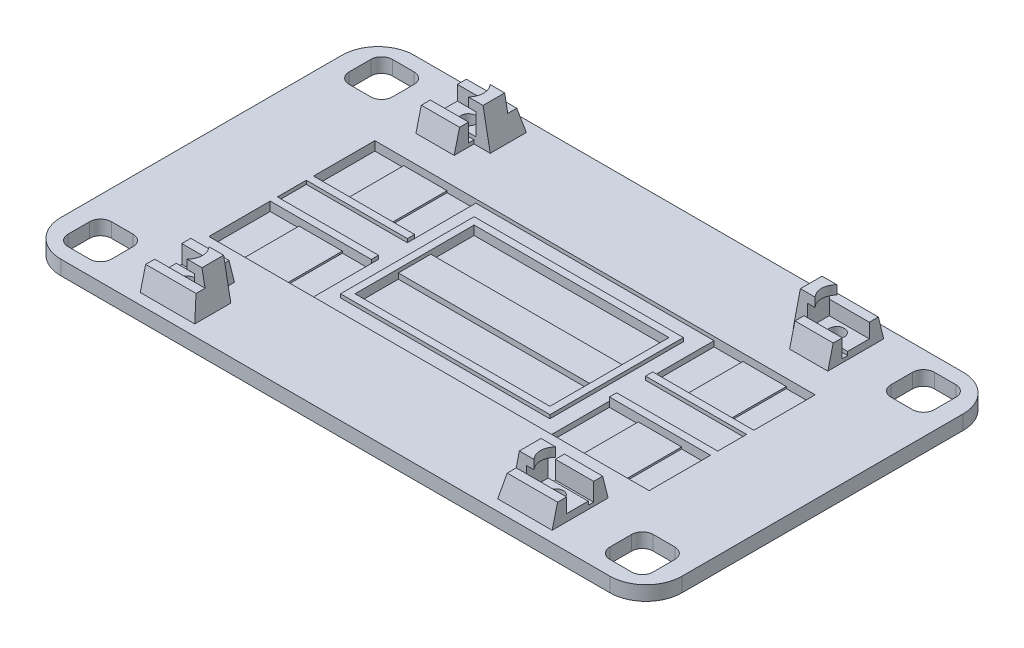
from build123d import *

# Parameters (mm, degrees)
SKETCH1_W                        = 34.5
SKETCH1_H                        = 8.741142107
BOSS_EXTRUDE3_DEPTH              = 4
SKETCH6_W                        = 11
SKETCH6_H                        = 11
BOSS_EXTRUDE4_DEPTH              = 2
CUT_EXTRUDE1_START               = -3
CUT_EXTRUDE1_DEPTH               = 24
SKETCH7_W                        = 11
SKETCH7_H                        = 2.5
SKETCH7_H_2                      = 1
BOSS_EXTRUDE5_DEPTH              = 4
SKETCH10_W                       = 3.083691557
SKETCH10_H                       = 13.597950321
CUT_EXTRUDE2_DEPTH               = 12
SKETCH11_W                       = 10.179154034
SKETCH11_H                       = 1.5
BOSS_EXTRUDE7_DEPTH              = 6
SKETCH12_W                       = 2.5
SKETCH12_H                       = 12.5
BOSS_EXTRUDE8_DEPTH              = 6
BOSS_EXTRUDE9_DEPTH              = 11.6
SKETCH21_R                       = 4.5
CUT_EXTRUDE9_DEPTH               = 3
CUT_EXTRUDE11_DEPTH              = 11.5
BOSS_EXTRUDE14_DEPTH             = 4
CUT_EXTRUDE12_START              = -1
SKETCH28_W                       = 13.111544153
SKETCH28_H                       = 1.5
CUT_EXTRUDE12_DEPTH              = 11
BOSS_EXTRUDE15_DEPTH             = 1.5
SKETCH30_W                       = 2.5
SKETCH30_H                       = 6
BOSS_EXTRUDE16_DEPTH             = 2
SKETCH31_W                       = 2.5
SKETCH31_H                       = 6
BOSS_EXTRUDE17_DEPTH             = 2.5
BOSS_EXTRUDE18_REACH             = 127.805
BOSS_EXTRUDE18_DIRECTION_2_REACH = 127.805
SKETCH34_W                       = 17.603907028
SKETCH34_H                       = 5.411961877
SKETCH34_H_2                     = 6.558600434
CUT_EXTRUDE13_DEPTH              = 4.5
BOSS_EXTRUDE20_DEPTH             = 11.6
MIRROR11_OUTLINE_R               = 4.5
MIRROR11_DEPTH                   = 3
MIRROR11_START                   = 3
MIRROR11_2_OUTLINE_R             = 2.069860115
MIRROR11_2_DEPTH                 = 1
MIRROR11_START_2                 = 4
MIRROR11_3_OUTLINE_R             = 2.069860115
MIRROR11_3_DEPTH                 = 2
MIRROR11_START_3                 = 6
MIRROR11_4_DEPTH                 = 4
MIRROR11_5_OUTLINE_W             = 13.1
MIRROR11_5_OUTLINE_H             = 1.5
MIRROR11_5_DEPTH                 = 1
MIRROR11_START_4                 = 12
MIRROR11_6_DEPTH                 = 2.5
MIRROR11_START_5                 = -59.844904725
MIRROR11_7_OUTLINE_W             = 6
MIRROR11_7_OUTLINE_H             = 2.5
MIRROR11_7_DEPTH                 = 15.1
MIRROR11_START_6                 = -49.244904725
MIRROR11_8_OUTLINE_W             = 10.5
MIRROR11_8_OUTLINE_H             = 6
MIRROR11_8_DEPTH                 = 4.5
MIRROR11_START_7                 = -46.744904725
MIRROR11_9_OUTLINE_W             = 6
MIRROR11_9_OUTLINE_H             = 1.5
MIRROR11_9_DEPTH                 = 2
MIRROR11_10_DEPTH                = 1.5
MIRROR11_START_8                 = -43.206197131
MIRROR11_11_DEPTH                = 3.206197131
BOSS_EXTRUDE21_DEPTH             = 11.6
CUT_EXTRUDE14_START              = -5
SKETCH37_W                       = 89.881860183
SKETCH37_H                       = 1.5
SKETCH37_W_2                     = 87.938782422
CUT_EXTRUDE14_DEPTH              = 5
SKETCH39_W                       = 7.636808492
SKETCH39_H                       = 7.005250269
CUT_EXTRUDE18_DEPTH              = 6
MIRROR13_COPY_1_SKETCH_W         = 7.636808492
MIRROR13_COPY_1_SKETCH_H         = 7.005250269
MIRROR13_COPY_1_DEPTH            = 6
SKETCH41_W                       = 6
SKETCH41_H                       = 6
CUT_EXTRUDE20_DEPTH              = 0.5
SKETCH42_W                       = 122
SKETCH42_H                       = 46
CUT_EXTRUDE21_DEPTH              = 1
SKETCH43_W                       = 24
SKETCH43_H                       = 2
BOSS_EXTRUDE23_DEPTH             = 1
SKETCH44_W                       = 4
SKETCH44_H                       = 17
CUT_EXTRUDE22_DEPTH              = 1.5
SKETCH45_W                       = 16
SKETCH45_H                       = 17
CUT_EXTRUDE23_DEPTH              = 1
SKETCH46_W                       = 58
SKETCH46_H                       = 37
SKETCH46_W_2                     = 54
SKETCH46_H_2                     = 33
BOSS_EXTRUDE25_DEPTH             = 1
SKETCH47_W                       = 54
SKETCH47_H                       = 12
CUT_EXTRUDE24_DEPTH              = 1.5
SKETCH48_W                       = 4
SKETCH48_H                       = 17
CUT_EXTRUDE25_DEPTH              = 1.5
SKETCH49_W                       = 4
SKETCH49_H                       = 17
CUT_EXTRUDE26_DEPTH              = 0.5
SKETCH50_W                       = 4
SKETCH50_H                       = 2
BOSS_EXTRUDE26_DEPTH             = 1


with BuildPart() as part:
    # Sketch1 → Boss-Extrude3 (new body)
    # profile 1 of 11: a face of its own
    with BuildSketch(Plane(origin=(0, 0, 0), x_dir=(1, 0, 0), z_dir=(0, 1, 0))):
        with BuildLine():
            Line((73.923306644, 42.779769086), (-59.063365063, 42.779769086))
            ThreePointArc((-59.063365063, 42.779769086), (-65.244285922, 40.219547838), (-67.804507169, 34.03862698))
            Line((-67.804507169, 34.03862698), (-67.804507169, -34.03862698))
            ThreePointArc((-67.804507169, -34.03862698), (-65.244285922, -40.219547838), (-59.063365063, -42.779769086))
            Line((-59.063365063, -42.779769086), (73.923306644, -42.779769086))
            ThreePointArc((73.923306644, -42.779769086), (80.104227503, -40.219547838), (82.664448751, -34.03862698))
            Line((82.664448751, -34.03862698), (82.664448751, 34.03862698))
            ThreePointArc((82.664448751, 34.03862698), (80.104227503, 40.219547838), (73.923306644, 42.779769086))
        make_face()
        with Locations((61.043877697, 34.03862698)):
            Rectangle(SKETCH1_W, SKETCH1_H, mode=Mode.SUBTRACT)
    # profile 2 of 11: a face of its own
    with BuildSketch(Plane(origin=(0, 0, 0), x_dir=(1, 0, 0), z_dir=(0, 1, 0))):
        with BuildLine():
            Line((78.293877697, 29.668055926), (78.293877697, 34.03862698))
            Line((78.293877697, 34.03862698), (74.273170351, 34.03862698))
            ThreePointArc((74.273170351, 34.03862698), (72.293877697, 32.059334326), (70.314585044, 34.03862698))
            Line((70.314585044, 34.03862698), (50.363737812, 34.03862698))
            ThreePointArc((50.363737812, 34.03862698), (48.293877697, 31.968766864), (46.224017582, 34.03862698))
            Line((46.224017582, 34.03862698), (43.793877697, 34.03862698))
            Line((43.793877697, 34.03862698), (43.793877697, 29.668055926))
            Line((43.793877697, 29.668055926), (78.293877697, 29.668055926))
        make_face()
    # profile 3 of 11: a face of its own
    with BuildSketch(Plane(origin=(0, 0, 0), x_dir=(1, 0, 0), z_dir=(0, 1, 0))):
        with BuildLine():
            Line((78.293877697, 34.03862698), (78.293877697, 38.409198033))
            Line((78.293877697, 38.409198033), (43.793877697, 38.409198033))
            Line((43.793877697, 38.409198033), (43.793877697, 34.03862698))
            Line((43.793877697, 34.03862698), (46.224017582, 34.03862698))
            ThreePointArc((46.224017582, 34.03862698), (48.293877697, 36.108487095), (50.363737812, 34.03862698))
            Line((50.363737812, 34.03862698), (70.314585044, 34.03862698))
            ThreePointArc((70.314585044, 34.03862698), (72.293877697, 36.017919633), (74.273170351, 34.03862698))
            Line((74.273170351, 34.03862698), (78.293877697, 34.03862698))
        make_face()
    # profile 4 of 11: a face of its own
    with BuildSketch(Plane(origin=(0, 0, 0), x_dir=(1, 0, 0), z_dir=(0, 1, 0))):
        with BuildLine():
            ThreePointArc((70.314585044, 34.03862698), (72.293877697, 32.059334326), (74.273170351, 34.03862698))
            Line((74.273170351, 34.03862698), (70.314585044, 34.03862698))
        make_face()
    # profile 5 of 11: a face of its own
    with BuildSketch(Plane(origin=(0, 0, 0), x_dir=(1, 0, 0), z_dir=(0, 1, 0))):
        with BuildLine():
            Line((70.314585044, 34.03862698), (74.273170351, 34.03862698))
            ThreePointArc((74.273170351, 34.03862698), (72.293877697, 36.017919633), (70.314585044, 34.03862698))
        make_face()
    # profile 6 of 11: a face of its own
    with BuildSketch(Plane(origin=(0, 0, 0), x_dir=(1, 0, 0), z_dir=(0, 1, 0))):
        with BuildLine():
            ThreePointArc((70.314585044, 34.03862698), (72.293877697, 32.059334326), (74.273170351, 34.03862698))
            Line((74.273170351, 34.03862698), (70.314585044, 34.03862698))
        make_face()
    # profile 7 of 11: a face of its own
    with BuildSketch(Plane(origin=(0, 0, 0), x_dir=(1, 0, 0), z_dir=(0, 1, 0))):
        with BuildLine():
            Line((70.314585044, 34.03862698), (74.273170351, 34.03862698))
            ThreePointArc((74.273170351, 34.03862698), (72.293877697, 36.017919633), (70.314585044, 34.03862698))
        make_face()
    # profile 8 of 11: a face of its own
    with BuildSketch(Plane(origin=(0, 0, 0), x_dir=(1, 0, 0), z_dir=(0, 1, 0))):
        with BuildLine():
            ThreePointArc((50.363737812, 34.03862698), (48.293877697, 36.108487095), (46.224017582, 34.03862698))
            Line((46.224017582, 34.03862698), (50.363737812, 34.03862698))
        make_face()
    # profile 9 of 11: a face of its own
    with BuildSketch(Plane(origin=(0, 0, 0), x_dir=(1, 0, 0), z_dir=(0, 1, 0))):
        with BuildLine():
            Line((50.363737812, 34.03862698), (46.224017582, 34.03862698))
            ThreePointArc((46.224017582, 34.03862698), (48.293877697, 31.968766864), (50.363737812, 34.03862698))
        make_face()
    # profile 10 of 11: a face of its own
    with BuildSketch(Plane(origin=(0, 0, 0), x_dir=(1, 0, 0), z_dir=(0, 1, 0))):
        with BuildLine():
            ThreePointArc((50.363737812, 34.03862698), (48.293877697, 36.108487095), (46.224017582, 34.03862698))
            Line((46.224017582, 34.03862698), (50.363737812, 34.03862698))
        make_face()
    # profile 11 of 11: a face of its own
    with BuildSketch(Plane(origin=(0, 0, 0), x_dir=(1, 0, 0), z_dir=(0, 1, 0))):
        with BuildLine():
            Line((50.363737812, 34.03862698), (46.224017582, 34.03862698))
            ThreePointArc((46.224017582, 34.03862698), (48.293877697, 31.968766864), (50.363737812, 34.03862698))
        make_face()
    extrude(amount=BOSS_EXTRUDE3_DEPTH)

    # Sketch6 → Boss-Extrude4 (add)
    with BuildSketch(Plane(origin=(0, 4, 0), x_dir=(1, 0, 0), z_dir=(0, 1, 0))):
        with Locations((48.114723663, 34.03862698)):
            Rectangle(SKETCH6_W, SKETCH6_H)
    boss_extrude4 = extrude(amount=BOSS_EXTRUDE4_DEPTH)

    # Sketch1<5> → Cut-Extrude1 (cut)
    with BuildSketch(Plane(origin=(0, 0, 0), x_dir=(1, 0, 0), z_dir=(0, 1, 0)).offset(CUT_EXTRUDE1_START)):
        with BuildLine():
            ThreePointArc((50.363737812, 34.03862698), (48.293877697, 36.108487095), (46.224017582, 34.03862698))
            Line((46.224017582, 34.03862698), (50.363737812, 34.03862698))
        make_face()
        with BuildLine():
            Line((50.363737812, 34.03862698), (46.224017582, 34.03862698))
            ThreePointArc((46.224017582, 34.03862698), (48.293877697, 31.968766864), (50.363737812, 34.03862698))
        make_face()
    cut_extrude1 = extrude(amount=CUT_EXTRUDE1_DEPTH, mode=Mode.SUBTRACT)

    # Sketch7 → Boss-Extrude5 (add)
    with BuildSketch(Plane(origin=(0, 6, 0), x_dir=(1, 0, 0), z_dir=(0, 1, 0))):
        with Locations((48.114723663, 38.28862698)):
            Rectangle(SKETCH7_W, SKETCH7_H)
        with Locations((48.114723663, 29.03862698)):
            Rectangle(SKETCH7_W, SKETCH7_H_2)
    boss_extrude5 = extrude(amount=BOSS_EXTRUDE5_DEPTH)

    # Sketch10 → Cut-Extrude2 (cut)
    with BuildSketch(Plane(origin=(0, 4, 0), x_dir=(1, 0, 0), z_dir=(0, 1, 0))):
        with Locations((54.335723476, 34.069991953)):
            Rectangle(SKETCH10_W, SKETCH10_H)
    cut_extrude2 = extrude(amount=CUT_EXTRUDE2_DEPTH, mode=Mode.SUBTRACT)

    # Sketch11 → Boss-Extrude7 (add)
    with BuildSketch(Plane(origin=(0, 4, 0), x_dir=(1, 0, 0), z_dir=(0, 1, 0))):
        with Locations((47.70430068, 27.78862698)):
            Rectangle(SKETCH11_W, SKETCH11_H)
    boss_extrude7 = extrude(amount=BOSS_EXTRUDE7_DEPTH)

    # Sketch12 → Boss-Extrude8 (add)
    with BuildSketch(Plane(origin=(0, 4, 0), x_dir=(1, 0, 0), z_dir=(0, 1, 0))):
        with Locations((42.443877697, 33.28862698)):
            Rectangle(SKETCH12_W, SKETCH12_H)
    boss_extrude8 = extrude(amount=BOSS_EXTRUDE8_DEPTH)

    # Sketch13 → Boss-Extrude9 (add)
    with BuildSketch(Plane.ZY.offset(-41.193877697)):
        Polygon((-27.03862698, 10), (-27.03862698, 4), (-25.53862698, 4), align=None)
        Polygon((-39.53862698, 10), (-39.53862698, 4), (-41.03862698, 4), align=None)
    extrude(amount=-BOSS_EXTRUDE9_DEPTH)

    # Sketch21 → Cut-Extrude9 (cut)
    with BuildSketch(Plane.XZ):
        with Locations(Location((48.293877697, -34.03862698, 0), (0, 0, 270))):
            Circle(SKETCH21_R)
    cut_extrude9 = extrude(amount=-CUT_EXTRUDE9_DEPTH, mode=Mode.SUBTRACT)

    # Sketch24 → Cut-Extrude11 (cut)
    with BuildSketch(Plane(origin=(0, 4, 0), x_dir=(1, 0, 0), z_dir=(0, 1, 0))):
        with BuildLine():
            Line((69.293877697, 40.03862698), (75.293877697, 40.03862698))
            ThreePointArc((75.293877697, 40.03862698), (77.415198041, 39.159947323), (78.293877697, 37.03862698))
            Line((78.293877697, 37.03862698), (78.293877697, 31.03862698))
            ThreePointArc((78.293877697, 31.03862698), (77.415198041, 28.917306636), (75.293877697, 28.03862698))
            Line((75.293877697, 28.03862698), (69.293877697, 28.03862698))
            ThreePointArc((69.293877697, 28.03862698), (67.172557354, 28.917306636), (66.293877697, 31.03862698))
            Line((66.293877697, 31.03862698), (66.293877697, 37.03862698))
            ThreePointArc((66.293877697, 37.03862698), (67.172557354, 39.159947323), (69.293877697, 40.03862698))
        make_face()
    cut_extrude11 = extrude(amount=-CUT_EXTRUDE11_DEPTH, mode=Mode.SUBTRACT)

    # Sketch26 → Boss-Extrude14 (add)
    with BuildSketch(Plane.XZ):
        with BuildLine():
            Line((-78.844904725, 53.842790723), (73.293877697, 53.842790723))
            ThreePointArc((73.293877697, 53.842790723), (80.364945509, 50.913858534), (83.293877697, 43.842790723))
            Line((83.293877697, 43.842790723), (83.293877697, -34.03862698))
            ThreePointArc((83.293877697, -34.03862698), (80.364945509, -41.109694791), (73.293877697, -44.03862698))
            Line((73.293877697, -44.03862698), (-78.844904725, -44.03862698))
            ThreePointArc((-78.844904725, -44.03862698), (-85.915972537, -41.109694791), (-88.844904725, -34.03862698))
            Line((-88.844904725, -34.03862698), (-88.844904725, 43.842790723))
            ThreePointArc((-88.844904725, 43.842790723), (-85.915972537, 50.913858534), (-78.844904725, 53.842790723))
        make_face()
        Polygon((39.621658068, -22.50744652), (81.471959084, -23.594467326), (79.917902441, -39.014138958), (77.090986998, -41.323408937), (59.598365076, -40.869055121), (39.621658068, -40.350179614), align=None, mode=Mode.SUBTRACT)
    extrude(amount=-BOSS_EXTRUDE14_DEPTH)

    # Sketch28 → Cut-Extrude12 (cut)
    with BuildSketch(Plane(origin=(0, 6, 0), x_dir=(1, 0, 0), z_dir=(0, 1, 0)).offset(CUT_EXTRUDE12_START)):
        with Locations((46.238105621, 30.28862698)):
            Rectangle(SKETCH28_W, SKETCH28_H)
    cut_extrude12 = extrude(amount=CUT_EXTRUDE12_DEPTH, mode=Mode.SUBTRACT)

    # Sketch29 → Boss-Extrude15 (add)
    with BuildSketch(Plane(origin=(52.793877697, 0, 0), x_dir=(0, 0, -1), z_dir=(1, 0, 0))):
        Polygon((37.03862698, 6), (31.03862698, 6), (31.03862698, 5), (29.53862698, 5), (29.53862698, 10), (27.03862698, 10), (25.53862698, 4), (41.03862698, 4), (39.53862698, 10), (37.03862698, 10), align=None)
    boss_extrude15 = extrude(amount=BOSS_EXTRUDE15_DEPTH)

    # Sketch30 → Boss-Extrude16 (add)
    with BuildSketch(Plane(origin=(0, 10, 0), x_dir=(1, 0, 0), z_dir=(0, 1, 0))):
        with Locations((42.443877697, 34.03862698)):
            Rectangle(SKETCH30_W, SKETCH30_H)
    boss_extrude16 = extrude(amount=BOSS_EXTRUDE16_DEPTH)

    # Sketch31 → Boss-Extrude17 (add)
    with BuildSketch(Plane(origin=(0, 12, 0), x_dir=(1, 0, 0), z_dir=(0, 1, 0))):
        with Locations((42.443877697, 34.03862698)):
            Rectangle(SKETCH31_W, SKETCH31_H)
        with BuildLine():
            Line((45.283479053, 37.03862698), (43.693877697, 37.03862698))
            Line((43.693877697, 37.03862698), (43.693877697, 31.03862698))
            Line((43.693877697, 31.03862698), (45.283479053, 31.03862698))
            ThreePointArc((45.283479053, 31.03862698), (44.043877697, 34.03862698), (45.283479053, 37.03862698))
        make_face()
    boss_extrude17 = extrude(amount=BOSS_EXTRUDE17_DEPTH)

    # Boss-Extrude18: up to this plane
    boss_extrude18_end = Plane(origin=(58.978536136, 4, -25.53862698), z_dir=(0, 0.2425356250363332, 0.9701425001453319))
    # Sketch33 → Boss-Extrude18 (add, up to the surface)
    with BuildSketch(Plane.XY.offset(-34.03862698), mode=Mode.PRIVATE) as boss_extrude18_sk1:
        Polygon((41.193877697, 14.5), (39.193877697, 4), (41.193877697, 4), align=None)
    boss_extrude18_tool1 = split(extrude(boss_extrude18_sk1.sketch, amount=BOSS_EXTRUDE18_REACH, mode=Mode.PRIVATE), bisect_by=boss_extrude18_end, keep=Keep.BOTH, mode=Mode.PRIVATE)
    boss_extrude18 = boss_extrude18_tool1.solids().sort_by_distance((40.527211, 7.5, -34.038627))[0]
    add(boss_extrude18)

    # Boss-Extrude18 direction 2: up to this plane
    boss_extrude18_direction_2_end = Plane(origin=(58.978536136, 4, -41.03862698), z_dir=(0, 0.2425356250363332, -0.9701425001453319))
    # Sketch33 → Boss-Extrude18 direction 2 (add, up to the surface)
    with BuildSketch(Plane.XY.offset(-34.03862698), mode=Mode.PRIVATE) as boss_extrude18_direction_2_sk1:
        Polygon((41.193877697, 14.5), (39.193877697, 4), (41.193877697, 4), align=None)
    boss_extrude18_direction_2_tool1 = split(extrude(boss_extrude18_direction_2_sk1.sketch, amount=-BOSS_EXTRUDE18_DIRECTION_2_REACH, mode=Mode.PRIVATE), bisect_by=boss_extrude18_direction_2_end, keep=Keep.BOTH, mode=Mode.PRIVATE)
    boss_extrude18_direction_2 = boss_extrude18_direction_2_tool1.solids().sort_by_distance((40.527211, 7.5, -34.038627))[0]
    add(boss_extrude18_direction_2)
    boss_extrude18 = boss_extrude18 + boss_extrude18_direction_2  # both directions under the feature's name, for the pattern or mirror that repeats it

    # Sketch34 → Cut-Extrude13 (cut)
    with BuildSketch(Plane(origin=(0, 14.5, 0), x_dir=(1, 0, 0), z_dir=(0, 1, 0))):
        with Locations((45.491924183, 39.744607919)):
            Rectangle(SKETCH34_W, SKETCH34_H)
        with Locations((45.491924183, 27.759326763)):
            Rectangle(SKETCH34_W, SKETCH34_H_2)
    cut_extrude13 = extrude(amount=-CUT_EXTRUDE13_DEPTH, mode=Mode.SUBTRACT)

    # Mirror9: Boss-Extrude4, Cut-Extrude1, Boss-Extrude5, Cut-Extrude2, Boss-Extrude7, Boss-Extrude8, Cut-Extrude9, Cut-Extrude11, Cut-Extrude12, Boss-Extrude15, Boss-Extrude16, Boss-Extrude17, Boss-Extrude18, Cut-Extrude13 across plane
    add(boss_extrude4.mirror(Plane.XY.offset(4.902081871)))
    add(cut_extrude1.mirror(Plane.XY.offset(4.902081871)), mode=Mode.SUBTRACT)
    add(boss_extrude5.mirror(Plane.XY.offset(4.902081871)))
    add(cut_extrude2.mirror(Plane.XY.offset(4.902081871)), mode=Mode.SUBTRACT)
    add(boss_extrude7.mirror(Plane.XY.offset(4.902081871)))
    add(boss_extrude8.mirror(Plane.XY.offset(4.902081871)))
    add(cut_extrude9.mirror(Plane.XY.offset(4.902081871)), mode=Mode.SUBTRACT)
    add(cut_extrude11.mirror(Plane.XY.offset(4.902081871)), mode=Mode.SUBTRACT)
    add(cut_extrude12.mirror(Plane.XY.offset(4.902081871)), mode=Mode.SUBTRACT)
    add(boss_extrude15.mirror(Plane.XY.offset(4.902081871)))
    add(boss_extrude16.mirror(Plane.XY.offset(4.902081871)))
    add(boss_extrude17.mirror(Plane.XY.offset(4.902081871)))
    add(boss_extrude18.mirror(Plane.XY.offset(4.902081871)))
    add(cut_extrude13.mirror(Plane.XY.offset(4.902081871)), mode=Mode.SUBTRACT)

    # Sketch35 → Boss-Extrude20 (add)
    with BuildSketch(Plane.ZY.offset(-52.793877697)):
        Polygon((35.342790723, 4), (36.842790723, 4), (36.842790723, 10), align=None)
        Polygon((50.842790723, 4), (49.342790723, 10), (49.342790723, 4), align=None)
    extrude(amount=BOSS_EXTRUDE20_DEPTH)

    # Mirror11: read off the stored shape, not the designer's step
    # Mirror11 outline → Mirror11 (cut)
    with BuildSketch(Plane(origin=(0, 0, 0), x_dir=(1, 0, 0), z_dir=(0, 1, 0))):
        with Locations((-53.844904725, 34.03862698)):
            Circle(MIRROR11_OUTLINE_R)
        with Locations((-53.844904725, -43.842790723)):
            Circle(MIRROR11_OUTLINE_R)
        with BuildLine():
            Line((-74.844904725, 40.03862698), (-80.844904725, 40.03862698))
            ThreePointArc((-80.844904725, 40.03862698), (-82.966225069, 39.159947323), (-83.844904725, 37.03862698))
            Line((-83.844904725, 37.03862698), (-83.844904725, 31.03862698))
            ThreePointArc((-83.844904725, 31.03862698), (-82.966225069, 28.917306636), (-80.844904725, 28.03862698))
            Line((-80.844904725, 28.03862698), (-74.844904725, 28.03862698))
            ThreePointArc((-74.844904725, 28.03862698), (-72.723584382, 28.917306636), (-71.844904725, 31.03862698))
            Line((-71.844904725, 31.03862698), (-71.844904725, 37.03862698))
            ThreePointArc((-71.844904725, 37.03862698), (-72.723584382, 39.159947323), (-74.844904725, 40.03862698))
        make_face()
        with BuildLine():
            ThreePointArc((-71.844904725, -40.842790723), (-72.723584382, -38.721470379), (-74.844904725, -37.842790723))
            Line((-74.844904725, -37.842790723), (-80.844904725, -37.842790723))
            ThreePointArc((-80.844904725, -37.842790723), (-82.966225069, -38.721470379), (-83.844904725, -40.842790723))
            Line((-83.844904725, -40.842790723), (-83.844904725, -46.842790723))
            ThreePointArc((-83.844904725, -46.842790723), (-82.966225069, -48.964111066), (-80.844904725, -49.842790723))
            Line((-80.844904725, -49.842790723), (-74.844904725, -49.842790723))
            ThreePointArc((-74.844904725, -49.842790723), (-72.723584382, -48.964111066), (-71.844904725, -46.842790723))
            Line((-71.844904725, -46.842790723), (-71.844904725, -40.842790723))
        make_face()
    extrude(amount=MIRROR11_DEPTH, mode=Mode.SUBTRACT)

    # Mirror11 2 outline → Mirror11 2 (cut)
    with BuildSketch(Plane(origin=(0, 0, 0), x_dir=(1, 0, 0), z_dir=(0, 1, 0)).offset(MIRROR11_START)):
        with Locations((-53.844904725, 34.03862698)):
            Circle(MIRROR11_2_OUTLINE_R)
        with Locations((-53.844904725, -43.842790723)):
            Circle(MIRROR11_2_OUTLINE_R)
        with BuildLine():
            Line((-74.844904725, 40.03862698), (-80.844904725, 40.03862698))
            ThreePointArc((-80.844904725, 40.03862698), (-82.966225069, 39.159947323), (-83.844904725, 37.03862698))
            Line((-83.844904725, 37.03862698), (-83.844904725, 31.03862698))
            ThreePointArc((-83.844904725, 31.03862698), (-82.966225069, 28.917306636), (-80.844904725, 28.03862698))
            Line((-80.844904725, 28.03862698), (-74.844904725, 28.03862698))
            ThreePointArc((-74.844904725, 28.03862698), (-72.723584382, 28.917306636), (-71.844904725, 31.03862698))
            Line((-71.844904725, 31.03862698), (-71.844904725, 37.03862698))
            ThreePointArc((-71.844904725, 37.03862698), (-72.723584382, 39.159947323), (-74.844904725, 40.03862698))
        make_face()
        with BuildLine():
            ThreePointArc((-71.844904725, -40.842790723), (-72.723584382, -38.721470379), (-74.844904725, -37.842790723))
            Line((-74.844904725, -37.842790723), (-80.844904725, -37.842790723))
            ThreePointArc((-80.844904725, -37.842790723), (-82.966225069, -38.721470379), (-83.844904725, -40.842790723))
            Line((-83.844904725, -40.842790723), (-83.844904725, -46.842790723))
            ThreePointArc((-83.844904725, -46.842790723), (-82.966225069, -48.964111066), (-80.844904725, -49.842790723))
            Line((-80.844904725, -49.842790723), (-74.844904725, -49.842790723))
            ThreePointArc((-74.844904725, -49.842790723), (-72.723584382, -48.964111066), (-71.844904725, -46.842790723))
            Line((-71.844904725, -46.842790723), (-71.844904725, -40.842790723))
        make_face()
    extrude(amount=MIRROR11_2_DEPTH, mode=Mode.SUBTRACT)

    # Mirror11 3 outline → Mirror11 3 (add)
    # profile 1 of 2: a face of its own
    with BuildSketch(Plane(origin=(0, 0, 0), x_dir=(1, 0, 0), z_dir=(0, 1, 0)).offset(MIRROR11_START_2)):
        with BuildLine():
            Line((-50.490802759, -46.842790723), (-49.244904725, -46.842790723))
            Line((-49.244904725, -46.842790723), (-49.244904725, -40.842790723))
            Line((-49.244904725, -40.842790723), (-59.844904725, -40.842790723))
            Line((-59.844904725, -40.842790723), (-59.844904725, -46.842790723))
            Line((-59.844904725, -46.842790723), (-57.199006691, -46.842790723))
            ThreePointArc((-57.199006691, -46.842790723), (-53.844904725, -48.342790723), (-50.490802759, -46.842790723))
        make_face()
        with Locations((-53.844904725, -43.842790723)):
            Circle(MIRROR11_3_OUTLINE_R, mode=Mode.SUBTRACT)
    # profile 2 of 2: a face of its own
    with BuildSketch(Plane(origin=(0, 0, 0), x_dir=(1, 0, 0), z_dir=(0, 1, 0)).offset(MIRROR11_START_2)):
        with BuildLine():
            Line((-49.244904725, 31.03862698), (-49.244904725, 37.03862698))
            Line((-49.244904725, 37.03862698), (-50.490802759, 37.03862698))
            ThreePointArc((-50.490802759, 37.03862698), (-53.844904725, 38.53862698), (-57.199006691, 37.03862698))
            Line((-57.199006691, 37.03862698), (-59.844904725, 37.03862698))
            Line((-59.844904725, 37.03862698), (-59.844904725, 31.03862698))
            Line((-59.844904725, 31.03862698), (-49.244904725, 31.03862698))
        make_face()
        with Locations((-53.844904725, 34.03862698)):
            Circle(MIRROR11_3_OUTLINE_R, mode=Mode.SUBTRACT)
    extrude(amount=MIRROR11_3_DEPTH)

    # Mirror11 4 outline → Mirror11 4 (add)
    with BuildSketch(Plane(origin=(0, 0, 0), x_dir=(1, 0, 0), z_dir=(0, 1, 0)).offset(MIRROR11_START_3)):
        with BuildLine():
            ThreePointArc((-57.199006691, -46.842790723), (-53.844904725, -48.342790723), (-50.490802759, -46.842790723))
            Line((-50.490802759, -46.842790723), (-57.199006691, -46.842790723))
        make_face()
        with BuildLine():
            Line((-57.199006691, 37.03862698), (-50.490802759, 37.03862698))
            ThreePointArc((-50.490802759, 37.03862698), (-53.844904725, 38.53862698), (-57.199006691, 37.03862698))
        make_face()
    extrude(amount=MIRROR11_4_DEPTH)

    # Mirror11 5 outline → Mirror11 5 (add)
    with BuildSketch(Plane(origin=(0, 0, 0), x_dir=(1, 0, 0), z_dir=(0, 1, 0)).offset(MIRROR11_START_2)):
        with Locations((-53.294904725, -40.092790723)):
            Rectangle(MIRROR11_5_OUTLINE_W, MIRROR11_5_OUTLINE_H)
        with Locations((-53.294904725, 30.28862698)):
            Rectangle(MIRROR11_5_OUTLINE_W, MIRROR11_5_OUTLINE_H)
    extrude(amount=MIRROR11_5_DEPTH)

    # Mirror11 7 outline → Mirror11 7 (add)
    with BuildSketch(Plane.YZ.offset(MIRROR11_START_5)):
        Polygon((4, 39.342790723), (4, 35.342790723), (10, 36.842790723), (10, 39.342790723), align=None)
        with Locations((7, -28.28862698)):
            Rectangle(MIRROR11_7_OUTLINE_W, MIRROR11_7_OUTLINE_H)
        with Locations((7, -38.28862698)):
            Rectangle(MIRROR11_7_OUTLINE_W, MIRROR11_7_OUTLINE_H)
        Polygon((4, 50.842790723), (4, 46.842790723), (10, 46.842790723), (10, 49.342790723), align=None)
    extrude(amount=MIRROR11_7_DEPTH)



with BuildPart() as body_2:
    # Mirror11 6 outline → Mirror11 6 (new body)
    with BuildSketch(Plane(origin=(0, 0, 0), x_dir=(1, 0, 0), z_dir=(0, 1, 0)).offset(MIRROR11_START_4)):
        with BuildLine():
            Line((-49.244904725, -46.842790723), (-49.244904725, -40.842790723))
            Line((-49.244904725, -40.842790723), (-50.834506081, -40.842790723))
            ThreePointArc((-50.834506081, -40.842790723), (-49.594904725, -43.842790723), (-50.834506081, -46.842790723))
            Line((-50.834506081, -46.842790723), (-49.244904725, -46.842790723))
        make_face()
        with BuildLine():
            Line((-49.244904725, 31.03862698), (-49.244904725, 37.03862698))
            Line((-49.244904725, 37.03862698), (-50.834506081, 37.03862698))
            ThreePointArc((-50.834506081, 37.03862698), (-49.594904725, 34.03862698), (-50.834506081, 31.03862698))
            Line((-50.834506081, 31.03862698), (-49.244904725, 31.03862698))
        make_face()
    extrude(amount=MIRROR11_6_DEPTH)


with BuildPart() as part_1:
    add(part.part)

    add(body_2.part)  # Mirror11 8 merges body 2
    # Mirror11 8 outline → Mirror11 8 (add)
    with BuildSketch(Plane.YZ.offset(MIRROR11_START_6)):
        with Locations((9.25, -34.03862698)):
            Rectangle(MIRROR11_8_OUTLINE_W, MIRROR11_8_OUTLINE_H)
        with Locations((9.25, 43.842790723)):
            Rectangle(MIRROR11_8_OUTLINE_W, MIRROR11_8_OUTLINE_H)
    extrude(amount=MIRROR11_8_DEPTH)

    # Mirror11 9 outline → Mirror11 9 (add)
    with BuildSketch(Plane.YZ.offset(MIRROR11_START_7)):
        with Locations((7, -30.28862698)):
            Rectangle(MIRROR11_9_OUTLINE_W, MIRROR11_9_OUTLINE_H)
        Polygon((4, -27.03862698), (10, -27.03862698), (4, -25.53862698), align=None)
        with Locations((7, 40.092790723)):
            Rectangle(MIRROR11_9_OUTLINE_W, MIRROR11_9_OUTLINE_H)
        Polygon((10, -39.53862698), (4, -39.53862698), (4, -41.03862698), align=None)
    extrude(amount=MIRROR11_9_DEPTH)

    # Mirror11 10 outline → Mirror11 10 (add)
    with BuildSketch(Plane.YZ.offset(MIRROR11_START_5)):
        Polygon((4, -27.03862698), (10, -27.03862698), (4, -25.53862698), align=None)
        Polygon((10, -39.53862698), (4, -39.53862698), (4, -41.03862698), align=None)
    extrude(amount=MIRROR11_10_DEPTH)

    # Mirror11 11 outline → Mirror11 11 (cut)
    with BuildSketch(Plane(origin=(0, 0, 0), x_dir=(-0.18711210788999502, 0.9823385664224749, 0), z_dir=(0.9823385664224749, 0.187112107889995, 0)).offset(MIRROR11_START_8)):
        Polygon((12.301667706, -41.03862698), (18.409541514, -39.53862698), (18.409541514, -37.03862698), (22.990446869, -37.03862698), (22.990446869, -31.03862698), (18.409541514, -31.03862698), (18.409541514, -27.03862698), (12.301667706, -25.53862698), align=None)
        Polygon((22.990446869, 40.842790723), (22.990446869, 46.842790723), (18.409541514, 46.842790723), (18.409541514, 49.342790723), (12.301667706, 50.842790723), (12.301667706, 35.342790723), (18.409541514, 36.842790723), (18.409541514, 40.842790723), align=None)
    extrude(amount=MIRROR11_11_DEPTH, mode=Mode.SUBTRACT)

    # Sketch36 → Boss-Extrude21 (add)
    with BuildSketch(Plane(origin=(-58.344904725, 0, 0), x_dir=(0, 0, -1), z_dir=(1, 0, 0))):
        Polygon((41.03862698, 4), (39.53862698, 10), (39.53862698, 4), align=None)
        Polygon((25.53862698, 4), (27.03862698, 4), (27.03862698, 10), align=None)
    extrude(amount=BOSS_EXTRUDE21_DEPTH)

    # Sketch37 → Cut-Extrude14 (cut)
    with BuildSketch(Plane(origin=(0, 10, 0), x_dir=(1, 0, 0), z_dir=(0, 1, 0)).offset(CUT_EXTRUDE14_START)):
        with Locations((-3.747052394, -40.092790723)):
            Rectangle(SKETCH37_W, SKETCH37_H)
        with Locations((-2.775513514, 30.28862698)):
            Rectangle(SKETCH37_W_2, SKETCH37_H)
    extrude(amount=CUT_EXTRUDE14_DEPTH, mode=Mode.SUBTRACT)

    # Sketch39 → Cut-Extrude18 (cut)
    with BuildSketch(Plane(origin=(0, 10, 0), x_dir=(1, 0, 0), z_dir=(0, 1, 0))):
        with Locations((-45.426500479, -37.340165588)):
            Rectangle(SKETCH39_W, SKETCH39_H)
    cut_extrude18 = extrude(amount=-CUT_EXTRUDE18_DEPTH, mode=Mode.SUBTRACT)

    # Mirror12: Cut-Extrude18 across plane
    add(cut_extrude18.mirror(Plane.XY.offset(4.902081871)), mode=Mode.SUBTRACT)

    # Mirror13: Cut-Extrude18 across plane
    add(cut_extrude18.mirror(Plane.ZY.offset(2.775513514)), mode=Mode.SUBTRACT)

    # Mirror13 copy 1 sketch → Mirror13 copy 1 (cut)
    with BuildSketch(Plane(origin=(-5.551027028, 10, 9.804163743), x_dir=(-1, 0, 0), z_dir=(0, 1, 0))):
        with Locations((-45.426500479, -37.340165588)):
            Rectangle(MIRROR13_COPY_1_SKETCH_W, MIRROR13_COPY_1_SKETCH_H)
    extrude(amount=-MIRROR13_COPY_1_DEPTH, mode=Mode.SUBTRACT)

    # Sketch41 → Cut-Extrude20 (cut)
    with BuildSketch(Plane(origin=(43.693877697, 0, 0), x_dir=(0, 0, -1), z_dir=(1, 0, 0))):
        with Locations((34.03862698, 9)):
            Rectangle(SKETCH41_W, SKETCH41_H)
        with Locations((-43.842790723, 9)):
            Rectangle(SKETCH41_W, SKETCH41_H)
    cut_extrude20 = extrude(amount=-CUT_EXTRUDE20_DEPTH, mode=Mode.SUBTRACT)

    # Mirror14: Cut-Extrude20 across plane
    add(cut_extrude20.mirror(Plane.ZY.offset(2.775513514)), mode=Mode.SUBTRACT)

    # Sketch42 → Cut-Extrude21 (cut)
    with BuildSketch(Plane(origin=(0, 4, 0), x_dir=(1, 0, 0), z_dir=(0, 1, 0))):
        with Locations((-2.775513514, -4.902081871)):
            Rectangle(SKETCH42_W, SKETCH42_H)
    extrude(amount=-CUT_EXTRUDE21_DEPTH, mode=Mode.SUBTRACT)

    # Sketch43 → Boss-Extrude23 (add)
    with BuildSketch(Plane(origin=(0, 3, 0), x_dir=(1, 0, 0), z_dir=(0, 1, 0))):
        with Locations((-51.775513514, -9.902081871)):
            Rectangle(SKETCH43_W, SKETCH43_H)
        with Locations((-51.775513514, 0.097918129)):
            Rectangle(SKETCH43_W, SKETCH43_H)
        with Locations((46.224486486, 0.097918129)):
            Rectangle(SKETCH43_W, SKETCH43_H)
        with Locations((46.224486486, -9.902081871)):
            Rectangle(SKETCH43_W, SKETCH43_H)
    extrude(amount=BOSS_EXTRUDE23_DEPTH)

    # Sketch44 → Cut-Extrude22 (cut)
    with BuildSketch(Plane(origin=(0, 3, 0), x_dir=(1, 0, 0), z_dir=(0, 1, 0))):
        with Locations((-61.775513514, -19.402081871)):
            Rectangle(SKETCH44_W, SKETCH44_H)
        with Locations((-41.775513514, -19.402081871)):
            Rectangle(SKETCH44_W, SKETCH44_H)
        with Locations((-61.775513514, 9.597918129)):
            Rectangle(SKETCH44_W, SKETCH44_H)
        with Locations((-41.775513514, 9.597918129)):
            Rectangle(SKETCH44_W, SKETCH44_H)
        with Locations((36.224486486, 9.597918129)):
            Rectangle(SKETCH44_W, SKETCH44_H)
        with Locations((56.224486486, 9.597918129)):
            Rectangle(SKETCH44_W, SKETCH44_H)
        with Locations((36.224486486, -19.402081871)):
            Rectangle(SKETCH44_W, SKETCH44_H)
        with Locations((56.224486486, -19.402081871)):
            Rectangle(SKETCH44_W, SKETCH44_H)
    extrude(amount=-CUT_EXTRUDE22_DEPTH, mode=Mode.SUBTRACT)

    # Sketch45 → Cut-Extrude23 (cut)
    with BuildSketch(Plane(origin=(0, 3, 0), x_dir=(1, 0, 0), z_dir=(0, 1, 0))):
        with Locations((-51.775513514, 9.597918129)):
            Rectangle(SKETCH45_W, SKETCH45_H)
        with Locations((-51.775513514, -19.402081871)):
            Rectangle(SKETCH45_W, SKETCH45_H)
        with Locations((46.224486486, 9.597918129)):
            Rectangle(SKETCH45_W, SKETCH45_H)
        with Locations((46.224486486, -19.402081871)):
            Rectangle(SKETCH45_W, SKETCH45_H)
    extrude(amount=-CUT_EXTRUDE23_DEPTH, mode=Mode.SUBTRACT)

    # Sketch46 → Boss-Extrude25 (add)
    with BuildSketch(Plane(origin=(0, 3, 0), x_dir=(1, 0, 0), z_dir=(0, 1, 0))):
        with Locations((-2.775513514, -4.902081871)):
            Rectangle(SKETCH46_W, SKETCH46_H)
        with Locations((-2.775513514, -4.902081871)):
            Rectangle(SKETCH46_W_2, SKETCH46_H_2, mode=Mode.SUBTRACT)
    extrude(amount=BOSS_EXTRUDE25_DEPTH)

    # Sketch47 → Cut-Extrude24 (cut)
    with BuildSketch(Plane(origin=(0, 3, 0), x_dir=(1, 0, 0), z_dir=(0, 1, 0))):
        with Locations((-2.775513514, 5.597918129)):
            Rectangle(SKETCH47_W, SKETCH47_H)
        with Locations((-2.775513514, -15.402081871)):
            Rectangle(SKETCH47_W, SKETCH47_H)
    extrude(amount=-CUT_EXTRUDE24_DEPTH, mode=Mode.SUBTRACT)

    # Sketch48 → Cut-Extrude25 (cut)
    with BuildSketch(Plane(origin=(0, 3, 0), x_dir=(1, 0, 0), z_dir=(0, 1, 0))):
        with Locations((-37.775513514, 9.597918129)):
            Rectangle(SKETCH48_W, SKETCH48_H)
        with Locations((-37.775513514, -19.402081871)):
            Rectangle(SKETCH48_W, SKETCH48_H)
        with Locations((32.224486486, 9.597918129)):
            Rectangle(SKETCH48_W, SKETCH48_H)
        with Locations((32.224486486, -19.402081871)):
            Rectangle(SKETCH48_W, SKETCH48_H)
    extrude(amount=-CUT_EXTRUDE25_DEPTH, mode=Mode.SUBTRACT)

    # Sketch49 → Cut-Extrude26 (cut)
    with BuildSketch(Plane(origin=(0, 2, 0), x_dir=(1, 0, 0), z_dir=(0, 1, 0))):
        with Locations((-57.775513514, 9.597918129)):
            Rectangle(SKETCH49_W, SKETCH49_H)
        with Locations((-57.775513514, -19.402081871)):
            Rectangle(SKETCH49_W, SKETCH49_H)
        with Locations((52.224486486, 9.597918129)):
            Rectangle(SKETCH49_W, SKETCH49_H)
        with Locations((52.224486486, -19.402081871)):
            Rectangle(SKETCH49_W, SKETCH49_H)
    extrude(amount=-CUT_EXTRUDE26_DEPTH, mode=Mode.SUBTRACT)

    # Sketch50 → Boss-Extrude26 (add)
    with BuildSketch(Plane(origin=(0, 3, 0), x_dir=(1, 0, 0), z_dir=(0, 1, 0))):
        with Locations((-37.775513514, 0.097918129)):
            Rectangle(SKETCH50_W, SKETCH50_H)
        with Locations((-37.775513514, -9.902081871)):
            Rectangle(SKETCH50_W, SKETCH50_H)
        with Locations((32.224486486, 0.097918129)):
            Rectangle(SKETCH50_W, SKETCH50_H)
        with Locations((32.224486486, -9.902081871)):
            Rectangle(SKETCH50_W, SKETCH50_H)
    extrude(amount=BOSS_EXTRUDE26_DEPTH)


solid = part_1.part
